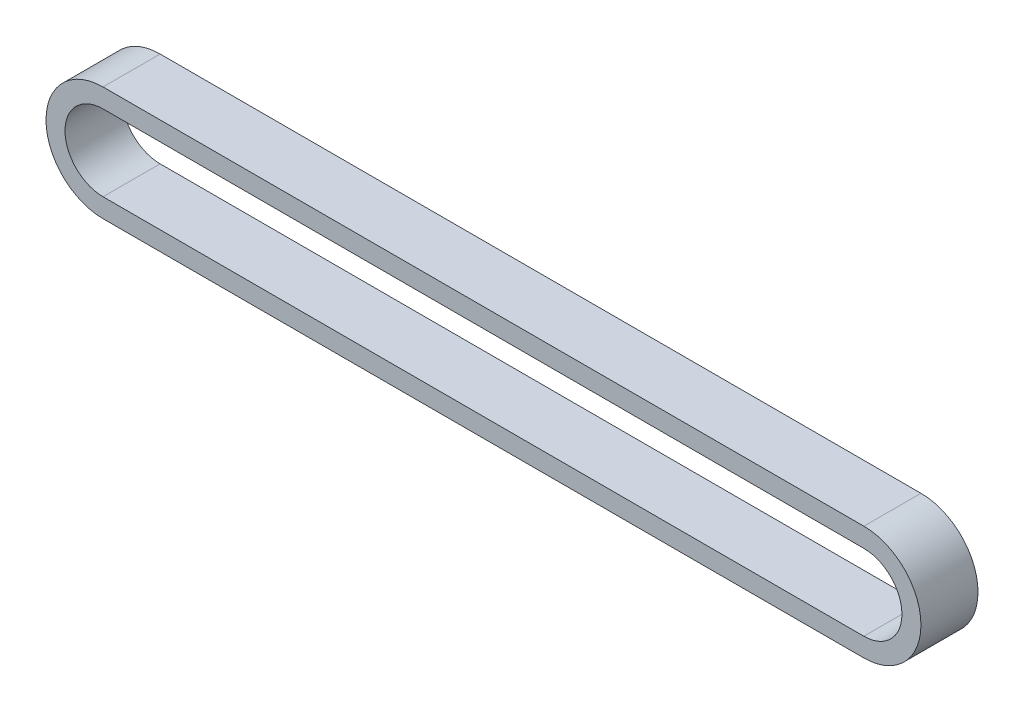
from build123d import *

# Parameters (mm, degrees)
SKETCH1_R          = 10
EXTRUDE1_DEPTH     = 15
CUT_EXTRUDE1_START = -15
CUT_EXTRUDE1_DEPTH = 15


# Read off the part's stored shape, not the designer's step: Cut-Extrude1
with BuildPart() as part:
    # Sketch1 → Extrude1 (new body)
    with BuildSketch(Plane.XY):
        with BuildLine():
            Line((-200, 15.05), (0, 15.05))
            ThreePointArc((0, 15.05), (15, 0.05), (0, -14.95))
            Line((0, -14.95), (-200, -14.95))
            ThreePointArc((-200, -14.95), (-215, 0.05), (-200, 15.05))
        make_face()
        with Locations((-200, 0.05)):
            Circle(SKETCH1_R, mode=Mode.SUBTRACT)
        Circle(SKETCH1_R, mode=Mode.SUBTRACT)
    extrude(amount=EXTRUDE1_DEPTH)

    # Cut-Extrude1 outline → Cut-Extrude1 (cut)
    with BuildSketch(Plane.XY.offset(15).offset(CUT_EXTRUDE1_START)):
        with BuildLine():
            ThreePointArc((-199.997500016, 10.049999688), (-190.000000313, 0.0475), (-200.002500016, -9.949999687))
            Line((-200.002500016, -9.949999687), (-0.002499984, -9.999999688))
            ThreePointArc((-0.002499984, -9.999999688), (-9.999999922, 0.001249992), (0, 10))
            Line((0, 10), (-199.997500016, 10.049999688))
        make_face()
    extrude(amount=CUT_EXTRUDE1_DEPTH, mode=Mode.SUBTRACT)


solid = part.part
